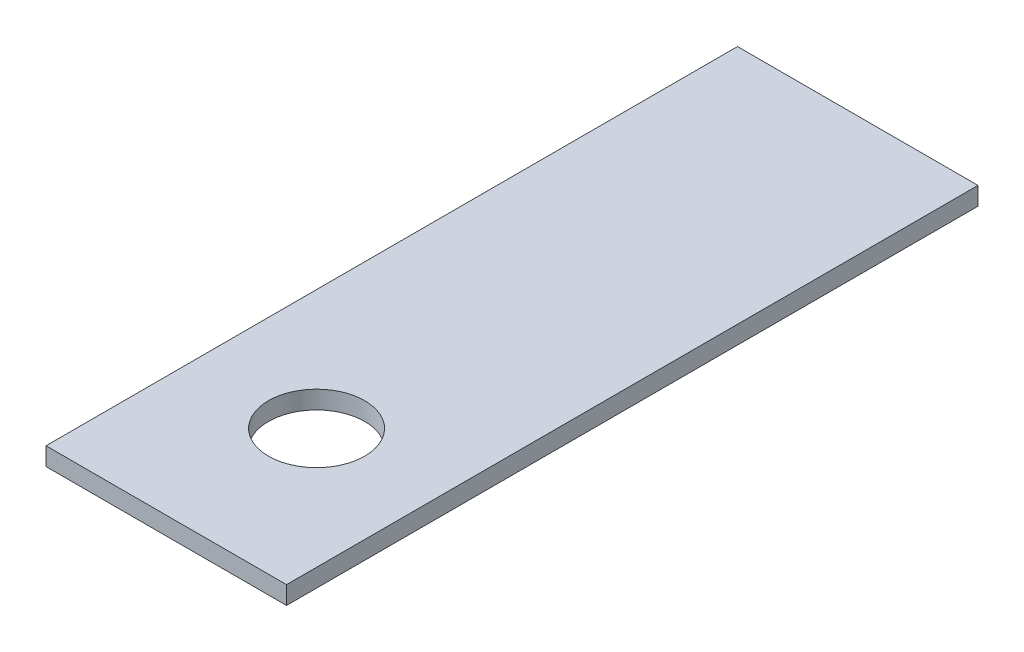
from build123d import *

# Parameters (mm, degrees)
SKETCH1_W                  = 80
SKETCH1_H                  = 230
BOSS_EXTRUDE1_DEPTH        = 6
F_32_0_32_DIAMETER_HOLE1_D = 32


with BuildPart() as part:
    # Sketch1 → Boss-Extrude1 (new body)
    with BuildSketch(Plane(origin=(0, 0, 0), x_dir=(1, 0, 0), z_dir=(0, 1, 0))):
        with Locations((40, -115)):
            Rectangle(SKETCH1_W, SKETCH1_H)
    extrude(amount=BOSS_EXTRUDE1_DEPTH)

    # Ø32.0 (32) Diameter Hole1 (through all)
    with Locations(Plane(origin=(0, 6, 0), x_dir=(1, 0, 0), z_dir=(0, 1, 0))):
        with Locations((40, -180)):
            Hole(F_32_0_32_DIAMETER_HOLE1_D / 2)


solid = part.part
